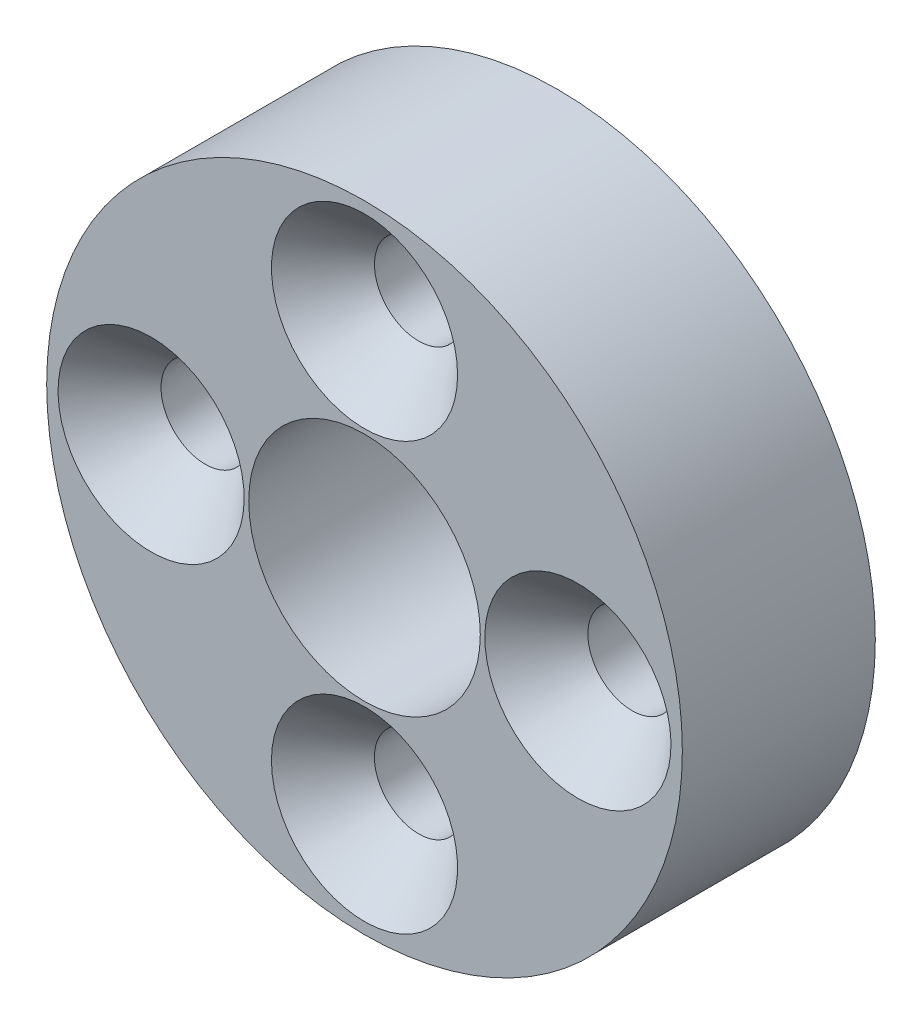
from build123d import *
from build123d.topology import SkipClean

# Parameters (mm, degrees)
SKETCH1_R           = 17.78
SKETCH1_R_2         = 2.4765
SKETCH1_R_3         = 6.477
BOSS_EXTRUDE1_DEPTH = 10.795
BOSS_EXTRUDE2_START = 3.175
SKETCH2_W           = 16.51
SKETCH2_H           = 16.51
SKETCH2_R           = 6.477
BOSS_EXTRUDE2_DEPTH = 3.175
CIRPATTERN4_COUNT   = 4


with BuildPart() as part:
    # Sketch1 → Boss-Extrude1 (new body)
    with BuildSketch(Plane.XY):
        Circle(SKETCH1_R)
        with Locations((-11.938, 0)):
            Circle(SKETCH1_R_2, mode=Mode.SUBTRACT)
        with Locations((0, -11.938)):
            Circle(SKETCH1_R_2, mode=Mode.SUBTRACT)
        with Locations((11.938, 0)):
            Circle(SKETCH1_R_2, mode=Mode.SUBTRACT)
        with Locations((0, 11.938)):
            Circle(SKETCH1_R_2, mode=Mode.SUBTRACT)
        Circle(SKETCH1_R_3, mode=Mode.SUBTRACT)
    extrude(amount=BOSS_EXTRUDE1_DEPTH)

    # Sketch2 → Boss-Extrude2 (add)
    with SkipClean():  # the faces are left unmerged after this step: merging them gives an invalid solid
        with BuildSketch(Plane(origin=(0, 0, 0), x_dir=(-1, 0, 0), z_dir=(0, 0, -1)).offset(BOSS_EXTRUDE2_START)):
            Rectangle(SKETCH2_W, SKETCH2_H)
            Circle(SKETCH2_R, mode=Mode.SUBTRACT)
        extrude(amount=-BOSS_EXTRUDE2_DEPTH)

    # Sketch5 → Cut-Revolve1 (revolve, cut)
    with SkipClean():  # the faces are left unmerged after this step: merging them gives an invalid solid
        with BuildSketch(Plane(origin=(0, 0, 0), x_dir=(0, 0, -1), z_dir=(1, 0, 0))):
            Polygon((-10.795, 11.938), (-10.795, 17.145), (-7.493, 14.171865846), (-7.493, 11.938), align=None)
        cut_revolve1 = revolve(axis=Axis((0, 11.938, 10.795), (0, 0, -1)), mode=Mode.SUBTRACT)

    # CirPattern4: Cut-Revolve1 ×4 about axis
    with SkipClean():  # the faces are left unmerged after this step: merging them gives an invalid solid
        cirpattern4_axis = Axis((0, 0, 10.795), (0, 0, 1))
        for i in range(1, CIRPATTERN4_COUNT):
            add(cut_revolve1.rotate(cirpattern4_axis, i * 360 / CIRPATTERN4_COUNT), mode=Mode.SUBTRACT)


solid = part.part
